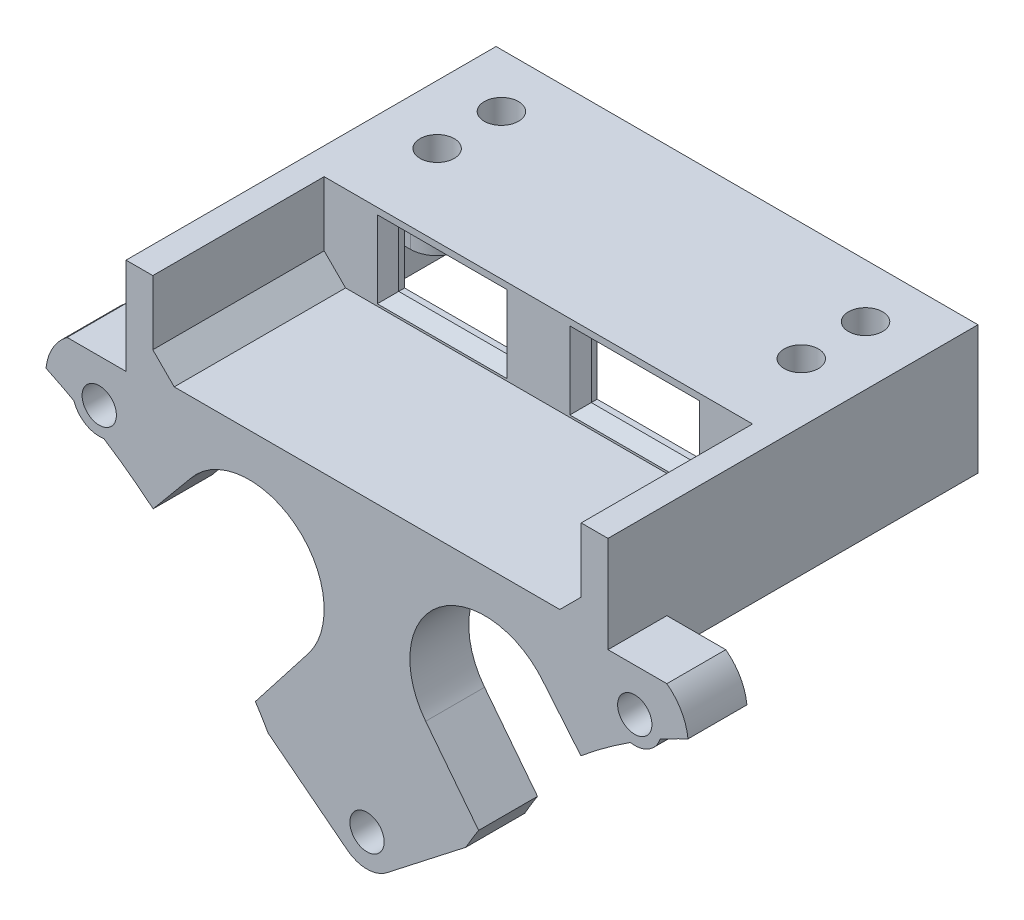
from build123d import *

# Parameters (mm, degrees)
EXTRUDE_1_DEPTH     = 34.55
SKETCH_2_W          = 40
SKETCH_2_H          = 8
CUT_EXTRUDE_1_DEPTH = 16
CUT_EXTRUDE_2_DEPTH = 10
SKETCH_4_W          = 10.1
SKETCH_4_H          = 5.2
CUT_EXTRUDE_3_DEPTH = 10
CHAMFER_1_SIZE      = 2
CHAMFER_2_SIZE      = 1
SKETCH_6_R          = 1.6
EXTRUDE_2_DEPTH     = 6.9
SKETCH_7_R          = 1.6
CUT_EXTRUDE_4_DEPTH = 10
SKETCH_8_R          = 1.6
EXTRUDE_3_DEPTH     = 5.5
SKETCH_10_W         = 40
SKETCH_10_H         = 10
CUT_EXTRUDE_5_DEPTH = 2


with BuildPart() as part:
    # 草图1 → 凸台-拉伸1 (new body)
    with BuildSketch(Plane.XY):
        Polygon((0, 0), (22.5, 0), (22.5, 12), (-22.5, 12), (-22.5, 0), align=None)
    extrude(amount=EXTRUDE_1_DEPTH)

    # 草图2 → 切除-拉伸1 (cut)
    with BuildSketch(Plane.XY.offset(34.55)):
        with Locations((0, 8)):
            Rectangle(SKETCH_2_W, SKETCH_2_H)
    extrude(amount=-CUT_EXTRUDE_1_DEPTH, mode=Mode.SUBTRACT)

    # 草图3 → 切除-拉伸2 (cut)
    with BuildSketch(Plane.XZ):
        Polygon((0, 2), (20, 2), (20, 17), (-20, 17), (-20, 2), align=None)
    extrude(amount=-CUT_EXTRUDE_2_DEPTH, mode=Mode.SUBTRACT)

    # 草图4 → 切除-拉伸3 (cut)
    with BuildSketch(Plane.XY.offset(18.55)):
        with Locations((-8.99, 7.8)):
            Rectangle(SKETCH_4_W, SKETCH_4_H)
        with Locations((8.99, 7.8)):
            Rectangle(SKETCH_4_W, SKETCH_4_H)
    extrude(amount=-CUT_EXTRUDE_3_DEPTH, mode=Mode.SUBTRACT)

    # 倒角1
    chamfer_1_edges = [part.edges().sort_by_distance(p)[0] for p in [
        (20, 4, 26.55),
        (-20, 4, 26.55),
    ]]
    chamfer(chamfer_1_edges, length=CHAMFER_1_SIZE)

    # 倒角2
    chamfer_2_edges = [part.edges().sort_by_distance(p)[0] for p in [
        (-8.99, 5.2, 18.55),
        (-14.04, 7.8, 18.55),
        (-8.99, 10.4, 18.55),
        (-3.94, 7.8, 18.55),
        (8.99, 10.4, 18.55),
        (3.94, 7.8, 18.55),
        (8.99, 5.2, 18.55),
        (14.04, 7.8, 18.55),
    ]]
    chamfer(chamfer_2_edges, length=CHAMFER_2_SIZE)

    # 草图6 → 凸台-拉伸2 (add)
    # profile 1 of 2: a face of its own
    with BuildSketch(Plane(origin=(0, 12, 0), x_dir=(1, 0, 0), z_dir=(0, 1, 0))):
        with BuildLine():
            Line((22.5, 0), (22.5, -13.5))
            Line((22.5, -13.5), (17, -13.5))
            ThreePointArc((17, -13.5), (15.232233047, -12.767766953), (14.5, -11))
            Line((14.5, -11), (14.5, -5))
            Line((14.5, -5), (14.5, 0))
            Line((14.5, 0), (22.5, 0))
        make_face()
        with Locations((17, -5)):
            Circle(SKETCH_6_R, mode=Mode.SUBTRACT)
        with Locations((17, -11)):
            Circle(SKETCH_6_R, mode=Mode.SUBTRACT)
    # profile 2 of 2: a face of its own
    with BuildSketch(Plane(origin=(0, 12, 0), x_dir=(1, 0, 0), z_dir=(0, 1, 0))):
        with BuildLine():
            Line((-14.5, 0), (-22.5, 0))
            Line((-22.5, 0), (-22.5, -13.5))
            Line((-22.5, -13.5), (-17, -13.5))
            ThreePointArc((-17, -13.5), (-15.232233047, -12.767766953), (-14.5, -11))
            Line((-14.5, -11), (-14.5, -5))
            Line((-14.5, -5), (-14.5, 0))
        make_face()
        with Locations((-17, -11)):
            Circle(SKETCH_6_R, mode=Mode.SUBTRACT)
        with Locations((-17, -5)):
            Circle(SKETCH_6_R, mode=Mode.SUBTRACT)
    extrude(amount=-EXTRUDE_2_DEPTH)

    # 草图7 → 切除-拉伸4 (cut)
    with BuildSketch(Plane(origin=(0, 12, 0), x_dir=(1, 0, 0), z_dir=(0, 1, 0))):
        with Locations((17, -5)):
            Circle(SKETCH_7_R)
        with Locations((17, -11)):
            Circle(SKETCH_7_R)
        with Locations((-17, -5)):
            Circle(SKETCH_7_R)
        with Locations((-17, -11)):
            Circle(SKETCH_7_R)
    extrude(amount=-CUT_EXTRUDE_4_DEPTH, mode=Mode.SUBTRACT)

    # 草图8 → 凸台-拉伸3 (add)
    with BuildSketch(Plane.XY.offset(34.55)):
        with BuildLine():
            Line((1.843049286, -25.367101461), (9.230566594, -19.615105309))
            ThreePointArc((9.230566594, -19.615105309), (9.814108465, -18.625953935), (10.421644381, -17.651355727))
            Line((10.421644381, -17.651355727), (5.476763257, -11.300448334))
            ThreePointArc((5.476763257, -11.300448334), (6.699551666, -1.476763257), (16.523236743, -2.699551666))
            Line((16.523236743, -2.699551666), (19.967990067, -6.846461039))
            ThreePointArc((19.967990067, -6.846461039), (22.224318463, -5.085470923), (24.58365332, -3.465087309))
            ThreePointArc((24.58365332, -3.465087309), (26.278709649, -3.148232211), (27.365383934, -1.809295278))
            ThreePointArc((27.365383934, -1.809295278), (28.658809968, -1.124546474), (29.972928279, -0.480399834))
            ThreePointArc((29.972928279, -0.480399834), (29.349734714, 1.46572665), (28, 3))
            Line((28, 3), (22.5, 3))
            Line((22.5, 3), (22.5, 4))
            Line((22.5, 4), (-22.5, 4))
            Line((-22.5, 4), (-22.5, 3))
            Line((-22.5, 3), (-28, 3))
            ThreePointArc((-28, 3), (-29.349734714, 1.46572665), (-29.972928279, -0.480399834))
            ThreePointArc((-29.972928279, -0.480399834), (-28.658809968, -1.124546474), (-27.365383934, -1.809295278))
            ThreePointArc((-27.365383934, -1.809295278), (-26.278709649, -3.148232211), (-24.58365332, -3.465087309))
            ThreePointArc((-24.58365332, -3.465087309), (-22.224318463, -5.085470923), (-19.967990067, -6.846461039))
            Line((-19.967990067, -6.846461039), (-16.523236743, -2.699551666))
            ThreePointArc((-16.523236743, -2.699551666), (-6.699551666, -1.476763257), (-5.476763257, -11.300448334))
            Line((-5.476763257, -11.300448334), (-10.421644381, -17.651355727))
            ThreePointArc((-10.421644381, -17.651355727), (-9.814108465, -18.625953935), (-9.230566594, -19.615105309))
            Line((-9.230566594, -19.615105309), (-1.843049286, -25.367101461))
            ThreePointArc((-1.843049286, -25.367101461), (0, -26), (1.843049286, -25.367101461))
        make_face()
        with Locations((25, -1)):
            Circle(SKETCH_8_R, mode=Mode.SUBTRACT)
        with Locations((0, -23)):
            Circle(SKETCH_8_R, mode=Mode.SUBTRACT)
        with Locations((-25, -1)):
            Circle(SKETCH_8_R, mode=Mode.SUBTRACT)
    extrude(amount=-EXTRUDE_3_DEPTH)

    # 草图10 → 切除-拉伸5 (cut)
    with BuildSketch(Plane(origin=(0, 0, 0), x_dir=(-1, 0, 0), z_dir=(0, 0, -1))):
        with Locations((0, 5)):
            Rectangle(SKETCH_10_W, SKETCH_10_H)
    extrude(amount=-CUT_EXTRUDE_5_DEPTH, mode=Mode.SUBTRACT)


solid = part.part
